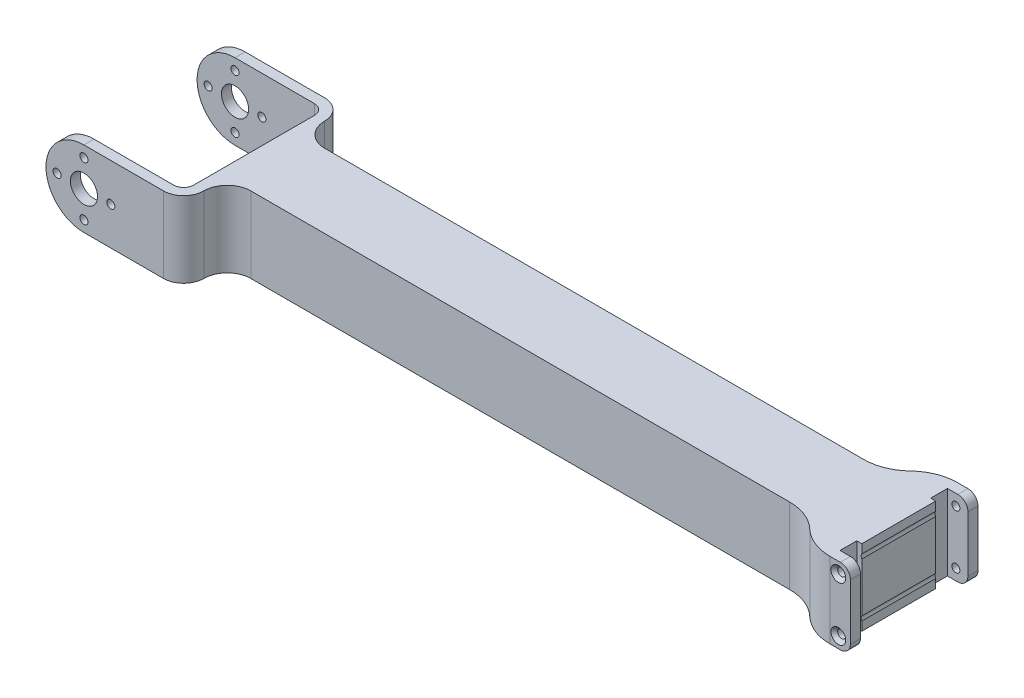
from build123d import *

# Parameters (mm, degrees)
BOSS_EXTRUDE3_DEPTH                                 = 22.6
FILLET2_R                                           = 11.3
BOSS_EXTRUDE4_DEPTH                                 = 22.6
CSK_FOR_M2_COUNTERSUNK_FLAT_HEAD_SCREW1_D           = 2.4
CSK_FOR_M2_COUNTERSUNK_FLAT_HEAD_SCREW1_CSINK_D     = 4.4
CSK_FOR_M2_COUNTERSUNK_FLAT_HEAD_SCREW1_CSINK_ANGLE = 90
FILLET3_R                                           = 3
FILLET3_OF_MIRROR4_R                                = 3
M2_CLEARANCE_HOLE1_D                                = 2.4
M2_CLEARANCE_HOLE1_DEPTH                            = 3
CIRPATTERN1_COUNT                                   = 4
F_8_1_8_1_DIAMETER_HOLE1_D                          = 8.1
F_8_1_8_1_DIAMETER_HOLE1_DEPTH                      = 3
F_8_1_8_1_DIAMETER_HOLE2_D                          = 8.1
M2_CLEARANCE_HOLE2_D                                = 2.4
CIRPATTERN2_COUNT                                   = 4


with BuildPart() as part:
    # Sketch4 → Boss-Extrude3 (new body)
    with BuildSketch(Plane(origin=(0, 0, 0), x_dir=(1, 0, 0), z_dir=(0, 1, 0))):
        with BuildLine():
            Line((0, -21), (0, -24))
            Line((0, -24), (35, -24))
            ThreePointArc((35, -24), (39.242640687, -22.242640687), (41, -18))
            ThreePointArc((41, -18), (43.050252532, -13.050252532), (48, -11))
            Line((48, -11), (230, -11))
            Line((230, -11), (230, 0))
            Line((230, 0), (38, 0))
            Line((38, 0), (38, -18))
            ThreePointArc((38, -18), (37.121320344, -20.121320344), (35, -21))
            Line((35, -21), (0, -21))
        make_face()
    extrude(amount=BOSS_EXTRUDE3_DEPTH)

    # Fillet2
    fillet2_edges = [part.edges().sort_by_distance(p)[0] for p in [
        (0, 0, 22.5),
        (0, 22.6, 22.5),
    ]]
    fillet(fillet2_edges, radius=FILLET2_R - 0.0001)  # a hair under: the kernel refuses the full size

    # Mirror3: part across plane


with BuildPart() as part_1:
    add(part.part)
    add(part.part.mirror(Plane.XY))

    # Sketch5 → Boss-Extrude4 (add, through all)
    with BuildSketch(Plane(origin=(0, 0, 0), x_dir=(1, 0, 0), z_dir=(0, 1, 0))):
        with BuildLine():
            Line((208.5, 11), (228.5, 11))
            Line((228.5, 11), (228.5, 16))
            Line((228.5, 16), (234.6, 16))
            Line((234.6, 16), (234.6, 19))
            Line((234.6, 19), (228.5, 19))
            ThreePointArc((228.5, 19), (223.114835193, 17.962912018), (218.5, 15))
            ThreePointArc((218.5, 15), (213.885164807, 12.037087982), (208.5, 11))
        make_face()
    boss_extrude4 = extrude(amount=BOSS_EXTRUDE4_DEPTH)

    # CSK for M2 Countersunk Flat Head Screw1 (through all)
    with Locations(Plane(origin=(231, 3.3, -19), x_dir=(-1, 0, 0), z_dir=(0, 0, -1))):
        with Locations((0, 0), (0, 16)):
            csk_for_m2_countersunk_flat_head_screw1 = CounterSinkHole(CSK_FOR_M2_COUNTERSUNK_FLAT_HEAD_SCREW1_D / 2, CSK_FOR_M2_COUNTERSUNK_FLAT_HEAD_SCREW1_CSINK_D / 2, counter_sink_angle=CSK_FOR_M2_COUNTERSUNK_FLAT_HEAD_SCREW1_CSINK_ANGLE)

    # Fillet3
    fillet3_edges = [part_1.edges().sort_by_distance(p)[0] for p in [
        (234.6, 0, -17.5),
        (234.6, 22.6, -17.5),
    ]]
    fillet(fillet3_edges, radius=FILLET3_R)

    # Mirror4: Boss-Extrude4, CSK for M2 Countersunk Flat Head Screw1 across plane
    add(boss_extrude4.mirror(Plane.XY))
    add(csk_for_m2_countersunk_flat_head_screw1.mirror(Plane.XY), mode=Mode.SUBTRACT)

    # Fillet3 of Mirror4
    fillet3_of_mirror4_edges = [part_1.edges().sort_by_distance(p)[0] for p in [
        (234.6, 0, 17.5),
        (234.6, 22.6, 17.5),
    ]]
    fillet(fillet3_of_mirror4_edges, radius=FILLET3_OF_MIRROR4_R)

    # M2 Clearance Hole1
    with Locations(Plane(origin=(3.3, 11.3, 24), x_dir=(1, 0, 0), z_dir=(0, 0, 1))):
        with Locations((0, 0)):
            m2_clearance_hole1 = Hole(M2_CLEARANCE_HOLE1_D / 2, depth=M2_CLEARANCE_HOLE1_DEPTH)

    # CirPattern1: M2 Clearance Hole1 ×4 about axis
    cirpattern1_axis = Axis((11.3, 11.3, 0), (0, 0, 1))
    for i in range(1, CIRPATTERN1_COUNT):
        add(m2_clearance_hole1.rotate(cirpattern1_axis, i * 360 / CIRPATTERN1_COUNT), mode=Mode.SUBTRACT)

    # Ø8.1 (8.1) Diameter Hole1
    with Locations(Plane(origin=(11.3, 11.3, -24), x_dir=(-1, 0, 0), z_dir=(0, 0, -1))):
        with Locations((0, 0)):
            Hole(F_8_1_8_1_DIAMETER_HOLE1_D / 2, depth=F_8_1_8_1_DIAMETER_HOLE1_DEPTH)

    # Ø8.1 (8.1) Diameter Hole2 (through all)
    with Locations(Plane(origin=(11.3, 11.3, 24), x_dir=(1, 0, 0), z_dir=(0, 0, 1))):
        with Locations((0, 0)):
            Hole(F_8_1_8_1_DIAMETER_HOLE2_D / 2)

    # M2 Clearance Hole2 (through all)
    with Locations(Plane(origin=(3.3, 11.3, -24), x_dir=(-1, 0, 0), z_dir=(0, 0, -1))):
        with Locations((0, 0)):
            m2_clearance_hole2 = Hole(M2_CLEARANCE_HOLE2_D / 2)

    # CirPattern2: M2 Clearance Hole2 ×4 about axis
    cirpattern2_axis = Axis((11.3, 11.3, 0), (0, 0, 1))
    for i in range(1, CIRPATTERN2_COUNT):
        add(m2_clearance_hole2.rotate(cirpattern2_axis, i * 360 / CIRPATTERN2_COUNT), mode=Mode.SUBTRACT)


solid = part_1.part
